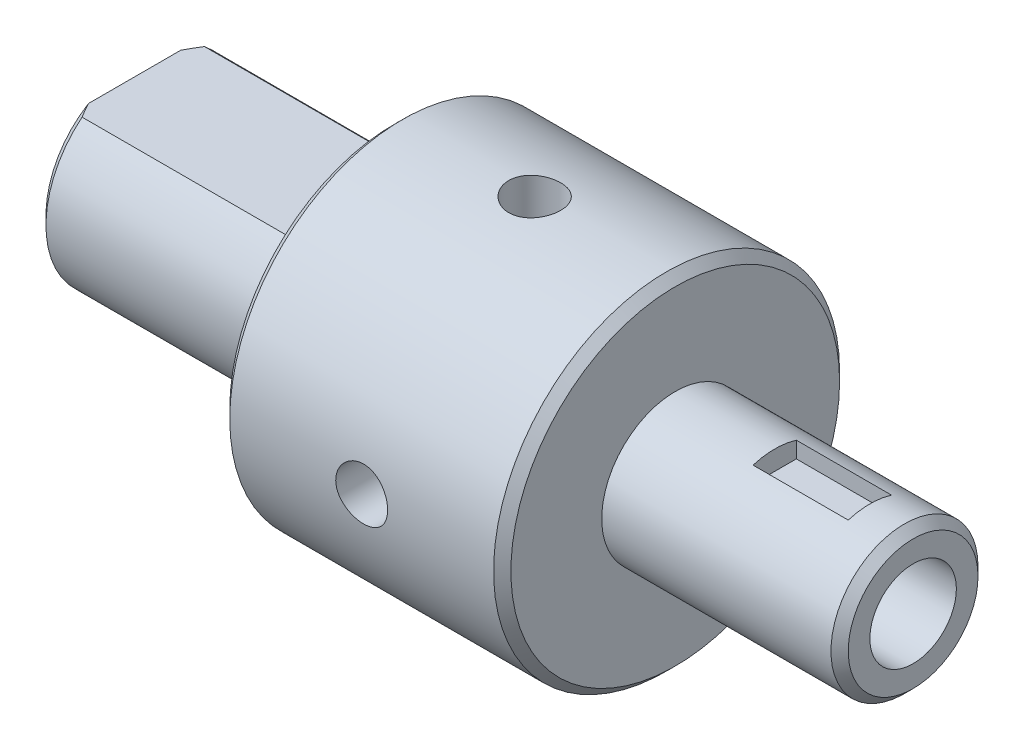
from build123d import *

# Parameters (mm, degrees)
SKETCH_6_W                = 22
SKETCH_6_H                = 4.5
CUT_EXTRUDE_4_DEPTH       = 5
CUT_EXTRUDE_11_DEPTH      = 189.679622641
CUT_EXTRUDE_11_DEPTH_BACK = 189.679622641
SKETCH_6_3_W              = 50
SKETCH_6_3_H              = 5
SKETCH_16_R               = 6
CUT_EXTRUDE_10_DEPTH      = 189.679622641
PATTERN_CIRCULAR_1_COUNT  = 4
CHAMFER_3_SIZE            = 2


with BuildPart() as part:
    # Эскиз1 → Повернуть1 (revolve)
    with BuildSketch(Plane.XY):
        Polygon((0, 10), (0, 22.5), (60, 22.5), (60, 40), (125, 40), (125, 17), (180, 17), (180, 10), align=None)
    revolve(axis=Axis((0, 0, 0), (-1, 0, 0)))

    # Эскиз6 → Вырез-Вытянуть4 (cut, symmetric)
    with BuildSketch(Plane.XY):
        with Locations((159, 14.75)):
            Rectangle(SKETCH_6_W, SKETCH_6_H)
    extrude(amount=CUT_EXTRUDE_4_DEPTH, both=True, mode=Mode.SUBTRACT)

    # Эскиз6<3> → Вырез-Вытянуть11 (cut, two sides: drawn at the far end of the back side and taken through both)
    with BuildSketch(Plane.XY.offset(-CUT_EXTRUDE_11_DEPTH_BACK)):
        with Locations((25, 20)):
            Rectangle(SKETCH_6_3_W, SKETCH_6_3_H)
    extrude(amount=CUT_EXTRUDE_11_DEPTH + CUT_EXTRUDE_11_DEPTH_BACK, mode=Mode.SUBTRACT)

    # Эскиз16 → Вырез-Вытянуть10 (cut, symmetric)
    with BuildSketch(Plane(origin=(0, 0, 0), x_dir=(1, 0, 0), z_dir=(0, 1, 0))):
        with Locations((92.5, 0)):
            Circle(SKETCH_16_R)
    cut_extrude_10 = extrude(amount=CUT_EXTRUDE_10_DEPTH, both=True, mode=Mode.SUBTRACT)

    # Круговой массив1: Вырез-Вытянуть10 ×4 about axis
    pattern_circular_1_axis = Axis((0, 0, 0), (1, 0, 0))
    for i in range(1, PATTERN_CIRCULAR_1_COUNT):
        add(cut_extrude_10.rotate(pattern_circular_1_axis, i * 360 / PATTERN_CIRCULAR_1_COUNT), mode=Mode.SUBTRACT)

    # Фаска3
    chamfer_3_edges = [part.edges().sort_by_distance(p)[0] for p in [
        (180, -17, 0),
        (0, -22.5, 0),
        (125, -40, 0),
        (60, -40, 0),
    ]]
    chamfer(chamfer_3_edges, length=CHAMFER_3_SIZE)


solid = part.part
